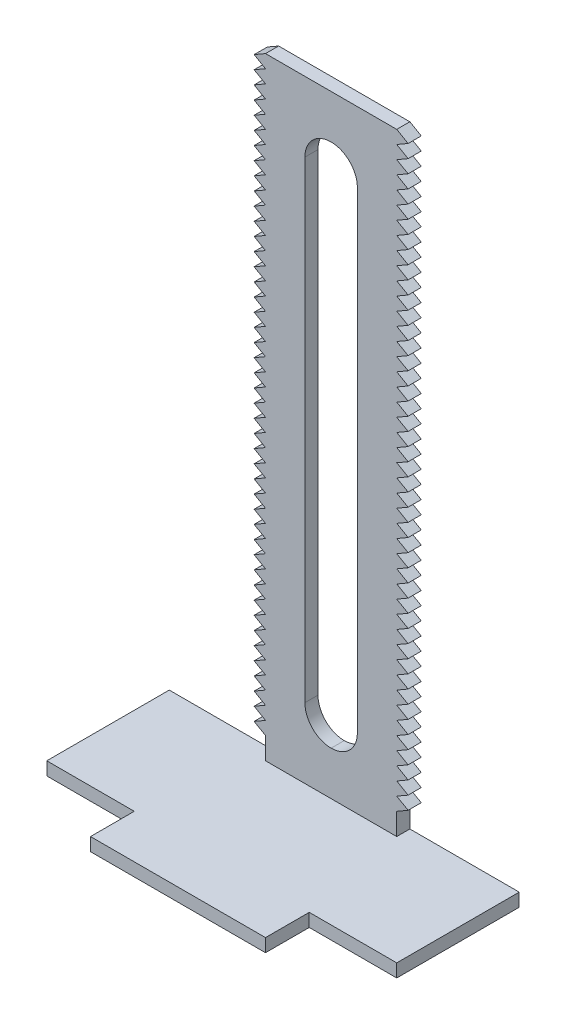
from build123d import *

# Parameters (mm, degrees)
SKETCH2_W            = 30
SKETCH2_H            = 3
BOSS_EXTRUDE1_DEPTH  = 110
BOSS_EXTRUDE2_DEPTH  = 3
SKETCH4_W            = 3
SKETCH4_H            = 3
BOSS_EXTRUDE3_DEPTH  = 3
SKETCH5_W            = 12
SKETCH5_H            = 90
CUT_EXTRUDE1_DEPTH   = 3
FILLET1_R            = 6
SKETCH7_W            = 3
SKETCH7_H            = 3
SKETCH7_W_2          = 6
BOSS_EXTRUDE8_DEPTH  = 10
SKETCH8_W            = 13
SKETCH8_H            = 3
BOSS_EXTRUDE9_DEPTH  = 3
SKETCH9_W            = 13
SKETCH9_H            = 3
BOSS_EXTRUDE10_DEPTH = 3
SKETCH10_W           = 13
SKETCH10_H           = 3
BOSS_EXTRUDE11_DEPTH = 3
SKETCH11_W           = 13
SKETCH11_H           = 3
BOSS_EXTRUDE12_DEPTH = 3
SKETCH12_W           = 13
SKETCH12_H           = 3
BOSS_EXTRUDE13_DEPTH = 25
SKETCH13_W           = 13
SKETCH13_H           = 3
BOSS_EXTRUDE14_DEPTH = 25
SKETCH14_W           = 80
SKETCH14_H           = 3
BOSS_EXTRUDE15_DEPTH = 25
SKETCH15_W           = 3
SKETCH15_H           = 38
BOSS_EXTRUDE16_DEPTH = 40
SKETCH16_W           = 20
SKETCH16_H           = 5
CUT_EXTRUDE2_DEPTH   = 3
SKETCH17_W           = 38
SKETCH17_H           = 40
CUT_EXTRUDE3_DEPTH   = 3
SKETCH19_W           = 30
SKETCH19_H           = 3
CUT_EXTRUDE4_DEPTH   = 3
SKETCH20_W           = 5
SKETCH20_H           = 3
BOSS_EXTRUDE17_DEPTH = 20
SKETCH21_W           = 20
SKETCH21_H           = 10
CUT_EXTRUDE5_DEPTH   = 3
SKETCH22_W           = 30
SKETCH22_H           = 3
BOSS_EXTRUDE18_DEPTH = 30
BOSS_EXTRUDE19_DEPTH = 3
SKETCH24_R           = 6
CUT_EXTRUDE7_DEPTH   = 3


with BuildPart() as part:
    # Sketch2 → Boss-Extrude1 (new body)
    with BuildSketch(Plane(origin=(0, 0, 0), x_dir=(1, 0, 0), z_dir=(0, 1, 0))):
        Rectangle(SKETCH2_W, SKETCH2_H)
    extrude(amount=BOSS_EXTRUDE1_DEPTH)

    # Sketch3 → Boss-Extrude2 (add)
    with BuildSketch(Plane.XY.offset(1.5)):
        Polygon((-15, 107), (-15, 110), (-17.598076211, 108.5), align=None)
        Polygon((-15, 104), (-15, 107), (-17.598076211, 105.5), align=None)
        Polygon((-15, 101), (-15, 104), (-17.598076211, 102.5), align=None)
        Polygon((-15, 98), (-15, 101), (-17.598076211, 99.5), align=None)
        Polygon((-15, 95), (-15, 98), (-17.598076211, 96.5), align=None)
        Polygon((-15, 92), (-15, 95), (-17.598076211, 93.5), align=None)
        Polygon((-15, 89), (-15, 92), (-17.598076211, 90.5), align=None)
        Polygon((-15, 86), (-15, 89), (-17.598076211, 87.5), align=None)
        Polygon((-15, 83), (-15, 86), (-17.598076211, 84.5), align=None)
        Polygon((-15, 80), (-15, 83), (-17.598076211, 81.5), align=None)
        Polygon((-15, 77), (-15, 80), (-17.598076211, 78.5), align=None)
        Polygon((17.598076211, 108.5), (15, 110), (15, 107), align=None)
        Polygon((17.598076211, 105.5), (15, 107), (15, 104), align=None)
        Polygon((17.598076211, 102.5), (15, 104), (15, 101), align=None)
        Polygon((17.598076211, 99.5), (15, 101), (15, 98), align=None)
        Polygon((17.598076211, 96.5), (15, 98), (15, 95), align=None)
        Polygon((17.598076211, 93.5), (15, 95), (15, 92), align=None)
        Polygon((17.598076211, 90.5), (15, 92), (15, 89), align=None)
        Polygon((17.598076211, 87.5), (15, 89), (15, 86), align=None)
        Polygon((17.598076211, 84.5), (15, 86), (15, 83), align=None)
        Polygon((17.598076211, 81.5), (15, 83), (15, 80), align=None)
        Polygon((17.598076211, 78.5), (15, 80), (15, 77), align=None)
        Polygon((-15, 74), (-15, 77), (-17.598076211, 75.5), align=None)
        Polygon((-15, 71), (-15, 74), (-17.598076211, 72.5), align=None)
        Polygon((-15, 68), (-15, 71), (-17.598076211, 69.5), align=None)
        Polygon((-15, 65), (-15, 68), (-17.598076211, 66.5), align=None)
        Polygon((-15, 62), (-15, 65), (-17.598076211, 63.5), align=None)
        Polygon((-15, 59), (-15, 62), (-17.598076211, 60.5), align=None)
        Polygon((-15, 56), (-15, 59), (-17.598076211, 57.5), align=None)
        Polygon((-15, 53), (-15, 56), (-17.598076211, 54.5), align=None)
        Polygon((-15, 50), (-15, 53), (-17.598076211, 51.5), align=None)
        Polygon((-15, 47), (-15, 50), (-17.598076211, 48.5), align=None)
        Polygon((-15, 44), (-15, 47), (-17.598076211, 45.5), align=None)
        Polygon((-15, 41), (-15, 44), (-17.598076211, 42.5), align=None)
        Polygon((-15, 38), (-15, 41), (-17.598076211, 39.5), align=None)
        Polygon((-15, 35), (-15, 38), (-17.598076211, 36.5), align=None)
        Polygon((17.598076211, 75.5), (15, 77), (15, 74), align=None)
        Polygon((17.598076211, 69.5), (15, 71), (15, 68), align=None)
        Polygon((17.598076211, 66.5), (15, 68), (15, 65), align=None)
        Polygon((17.598076211, 63.5), (15, 65), (15, 62), align=None)
        Polygon((17.598076211, 51.5), (15, 53), (15, 50), align=None)
        Polygon((17.598076211, 48.5), (15, 50), (15, 47), align=None)
        Polygon((17.598076211, 45.5), (15, 47), (15, 44), align=None)
        Polygon((17.598076211, 42.5), (15, 44), (15, 41), align=None)
        Polygon((17.598076211, 39.5), (15, 41), (15, 38), align=None)
        Polygon((17.598076211, 33.5), (15, 35), (15, 32), align=None)
        Polygon((17.598076211, 30.5), (15, 32), (15, 29), align=None)
        Polygon((-15, 32), (-15, 35), (-17.598076211, 33.5), align=None)
        Polygon((-15, 29), (-15, 32), (-17.598076211, 30.5), align=None)
        Polygon((-15, 26), (-15, 29), (-17.598076211, 27.5), align=None)
        Polygon((-15, 23), (-15, 26), (-17.598076211, 24.5), align=None)
        Polygon((-15, 20), (-15, 23), (-17.598076211, 21.5), align=None)
        Polygon((-15, 17), (-15, 20), (-17.598076211, 18.5), align=None)
        Polygon((17.598076211, 27.5), (15, 29), (15, 26), align=None)
        Polygon((17.598076211, 24.5), (15, 26), (15, 23), align=None)
        Polygon((-15, 14), (-15, 17), (-17.598076211, 15.5), align=None)
        Polygon((17.598076211, 21.5), (15, 23), (15, 20), align=None)
        Polygon((17.598076211, 18.5), (15, 20), (15, 17), align=None)
        Polygon((-15, 11), (-15, 14), (-17.598076211, 12.5), align=None)
        Polygon((17.598076211, 15.5), (15, 17), (15, 14), align=None)
        Polygon((17.598076211, 12.5), (15, 14), (15, 11), align=None)
        Polygon((17.598076211, 9.5), (15, 11), (15, 8), align=None)
        Polygon((17.598076211, 6.5), (15, 8), (15, 5), align=None)
        Polygon((-15, 5), (-15, 8), (-17.598076211, 6.5), align=None)
        Polygon((-15, 8), (-15, 11), (-17.598076211, 9.5), align=None)
        Polygon((15, 74), (17.598076211, 72.5), (15, 71), align=None)
        Polygon((15, 62), (17.598076211, 60.5), (15, 59), align=None)
        Polygon((15, 59), (17.598076211, 57.5), (15, 56), align=None)
        Polygon((15, 56), (17.598076211, 54.5), (15, 53), align=None)
        Polygon((15, 38), (17.598076211, 36.5), (15, 35), align=None)
    extrude(amount=-BOSS_EXTRUDE2_DEPTH)

    # Sketch4 → Boss-Extrude3 (add)
    with BuildSketch(Plane.XY.offset(1.5)):
        Polygon((-6, -3), (-9, -3), (-12, -3), (-15, -3), (-15, -6), (15, -6), (15, -3), (12, -3), (9, -3), (6, -3), (3, -3), (0, -3), (-3, -3), align=None)
        with Locations((-13.5, -1.5)):
            Rectangle(SKETCH4_W, SKETCH4_H)
        with Locations((-7.5, -1.5)):
            Rectangle(SKETCH4_W, SKETCH4_H)
        with Locations((-1.5, -1.5)):
            Rectangle(SKETCH4_W, SKETCH4_H)
        with Locations((1.5, -1.5)):
            Rectangle(SKETCH4_W, SKETCH4_H)
        with Locations((7.5, -1.5)):
            Rectangle(SKETCH4_W, SKETCH4_H)
        with Locations((13.5, -1.5)):
            Rectangle(SKETCH4_W, SKETCH4_H)
    extrude(amount=-BOSS_EXTRUDE3_DEPTH)

    # Sketch5 → Cut-Extrude1 (cut)
    with BuildSketch(Plane(origin=(0, 0, -1.5), x_dir=(-1, 0, 0), z_dir=(0, 0, -1))):
        with Locations((0, 55)):
            Rectangle(SKETCH5_W, SKETCH5_H)
    extrude(amount=-CUT_EXTRUDE1_DEPTH, mode=Mode.SUBTRACT)

    # Fillet1
    fillet1_edges = [part.edges().sort_by_distance(p)[0] for p in [
        (-6, 10, 0),
        (6, 10, 0),
        (6, 100, 0),
        (-6, 100, 0),
    ]]
    fillet(fillet1_edges, radius=FILLET1_R - 0.0001)  # a hair under: the kernel refuses the full size

    # Sketch7 → Boss-Extrude8 (add)
    with BuildSketch(Plane.XY.offset(1.5)):
        with Locations((-13.5, -1.5)):
            Rectangle(SKETCH7_W, SKETCH7_H)
        with Locations((-7.5, -1.5)):
            Rectangle(SKETCH7_W, SKETCH7_H)
        with Locations((0, -1.5)):
            Rectangle(SKETCH7_W_2, SKETCH7_H)
        with Locations((7.5, -1.5)):
            Rectangle(SKETCH7_W, SKETCH7_H)
        with Locations((13.5, -1.5)):
            Rectangle(SKETCH7_W, SKETCH7_H)
    extrude(amount=BOSS_EXTRUDE8_DEPTH)

    # Sketch8 → Boss-Extrude9 (add)
    with BuildSketch(Plane.ZY.offset(9)):
        with Locations((5, -1.5)):
            Rectangle(SKETCH8_W, SKETCH8_H)
    extrude(amount=BOSS_EXTRUDE9_DEPTH)

    # Sketch9 → Boss-Extrude10 (add)
    with BuildSketch(Plane.ZY.offset(3)):
        with Locations((5, -1.5)):
            Rectangle(SKETCH9_W, SKETCH9_H)
    extrude(amount=BOSS_EXTRUDE10_DEPTH)

    # Sketch10 → Boss-Extrude11 (add)
    with BuildSketch(Plane.ZY.offset(-6)):
        with Locations((5, -1.5)):
            Rectangle(SKETCH10_W, SKETCH10_H)
    extrude(amount=BOSS_EXTRUDE11_DEPTH)

    # Sketch11 → Boss-Extrude12 (add)
    with BuildSketch(Plane.ZY.offset(-12)):
        with Locations((5, -1.5)):
            Rectangle(SKETCH11_W, SKETCH11_H)
    extrude(amount=BOSS_EXTRUDE12_DEPTH)

    # Sketch12 → Boss-Extrude13 (add)
    with BuildSketch(Plane.ZY.offset(15)):
        with Locations((5, -1.5)):
            Rectangle(SKETCH12_W, SKETCH12_H)
    extrude(amount=BOSS_EXTRUDE13_DEPTH)

    # Sketch13 → Boss-Extrude14 (add)
    with BuildSketch(Plane(origin=(15, 0, 0), x_dir=(0, 0, -1), z_dir=(1, 0, 0))):
        with Locations((-5, -1.5)):
            Rectangle(SKETCH13_W, SKETCH13_H)
    extrude(amount=BOSS_EXTRUDE14_DEPTH)

    # Sketch14 → Boss-Extrude15 (add)
    with BuildSketch(Plane.XY.offset(11.5)):
        with Locations((0, -1.5)):
            Rectangle(SKETCH14_W, SKETCH14_H)
    extrude(amount=BOSS_EXTRUDE15_DEPTH)

    # Sketch15 → Boss-Extrude16 (add)
    with BuildSketch(Plane.XZ.offset(3)):
        with Locations((-31.5, 17.5)):
            Rectangle(SKETCH15_W, SKETCH15_H)
    extrude(amount=BOSS_EXTRUDE16_DEPTH)

    # Sketch16 → Cut-Extrude2 (cut)
    with BuildSketch(Plane.XZ.offset(3)):
        with Locations((30, 17.5)):
            Rectangle(SKETCH16_W, SKETCH16_H)
    extrude(amount=-CUT_EXTRUDE2_DEPTH, mode=Mode.SUBTRACT)

    # Sketch17 → Cut-Extrude3 (cut)
    with BuildSketch(Plane(origin=(-30, 0, 0), x_dir=(0, 0, -1), z_dir=(1, 0, 0))):
        with Locations((-17.5, -23)):
            Rectangle(SKETCH17_W, SKETCH17_H)
    extrude(amount=-CUT_EXTRUDE3_DEPTH, mode=Mode.SUBTRACT)

    # Sketch19 → Cut-Extrude4 (cut)
    with BuildSketch(Plane.XY.offset(1.5)):
        with Locations((0, -4.5)):
            Rectangle(SKETCH19_W, SKETCH19_H)
    extrude(amount=-CUT_EXTRUDE4_DEPTH, mode=Mode.SUBTRACT)

    # Sketch20 → Boss-Extrude17 (add)
    with BuildSketch(Plane(origin=(20, 0, 0), x_dir=(0, 0, -1), z_dir=(1, 0, 0))):
        with Locations((-17.5, -1.5)):
            Rectangle(SKETCH20_W, SKETCH20_H)
    extrude(amount=BOSS_EXTRUDE17_DEPTH)

    # Sketch21 → Cut-Extrude5 (cut)
    with BuildSketch(Plane(origin=(0, -3, 0), x_dir=(-1, 0, 0), z_dir=(0, -1, 0))):
        with Locations((30, -31.5)):
            Rectangle(SKETCH21_W, SKETCH21_H)
        with Locations((-30, -31.5)):
            Rectangle(SKETCH21_W, SKETCH21_H)
    extrude(amount=-CUT_EXTRUDE5_DEPTH, mode=Mode.SUBTRACT)

    # Sketch22 → Boss-Extrude18 (add)
    with BuildSketch(Plane(origin=(0, 110, 0), x_dir=(1, 0, 0), z_dir=(0, 1, 0))):
        Rectangle(SKETCH22_W, SKETCH22_H)
    extrude(amount=BOSS_EXTRUDE18_DEPTH)

    # Sketch23 → Boss-Extrude19 (add)
    with BuildSketch(Plane.XY.offset(1.5)):
        Polygon((-15, 137), (-17.598076211, 138.5), (-15, 140), align=None)
        Polygon((-15, 134), (-17.598076211, 135.5), (-15, 137), align=None)
        Polygon((-15, 131), (-17.598076211, 132.5), (-15, 134), align=None)
        Polygon((-15, 128), (-17.598076211, 129.5), (-15, 131), align=None)
        Polygon((-15, 125), (-17.598076211, 126.5), (-15, 128), align=None)
        Polygon((-15, 122), (-17.598076211, 123.5), (-15, 125), align=None)
        Polygon((-15, 119), (-17.598076211, 120.5), (-15, 122), align=None)
        Polygon((-15, 116), (-17.598076211, 117.5), (-15, 119), align=None)
        Polygon((-15, 113), (-17.598076211, 114.5), (-15, 116), align=None)
        Polygon((-15, 110), (-17.598076211, 111.5), (-15, 113), align=None)
        Polygon((15, 137), (17.598076211, 138.5), (15, 140), align=None)
        Polygon((15, 134), (15, 137), (17.598076211, 135.5), align=None)
        Polygon((15, 131), (17.598076211, 132.5), (15, 134), align=None)
        Polygon((15, 128), (17.598076211, 129.5), (15, 131), align=None)
        Polygon((15, 125), (17.598076211, 126.5), (15, 128), align=None)
        Polygon((15, 122), (17.598076211, 123.5), (15, 125), align=None)
        Polygon((15, 119), (15, 122), (17.598076211, 120.5), align=None)
        Polygon((15, 116), (15, 119), (17.598076211, 117.5), align=None)
        Polygon((15, 113), (15, 116), (17.598076211, 114.5), align=None)
        Polygon((15, 110), (15, 113), (17.598076211, 111.5), align=None)
    extrude(amount=-BOSS_EXTRUDE19_DEPTH)

    # Sketch24 → Cut-Extrude7 (cut)
    with BuildSketch(Plane.XY.offset(1.5)):
        with Locations((0, 124)):
            Circle(SKETCH24_R)
        with BuildLine():
            Line((-6, 124), (-6, 94))
            Line((-6, 94), (6, 94))
            Line((6, 94), (6, 124))
            ThreePointArc((6, 124), (0, 118), (-6, 124))
        make_face()
    extrude(amount=-CUT_EXTRUDE7_DEPTH, mode=Mode.SUBTRACT)


solid = part.part
